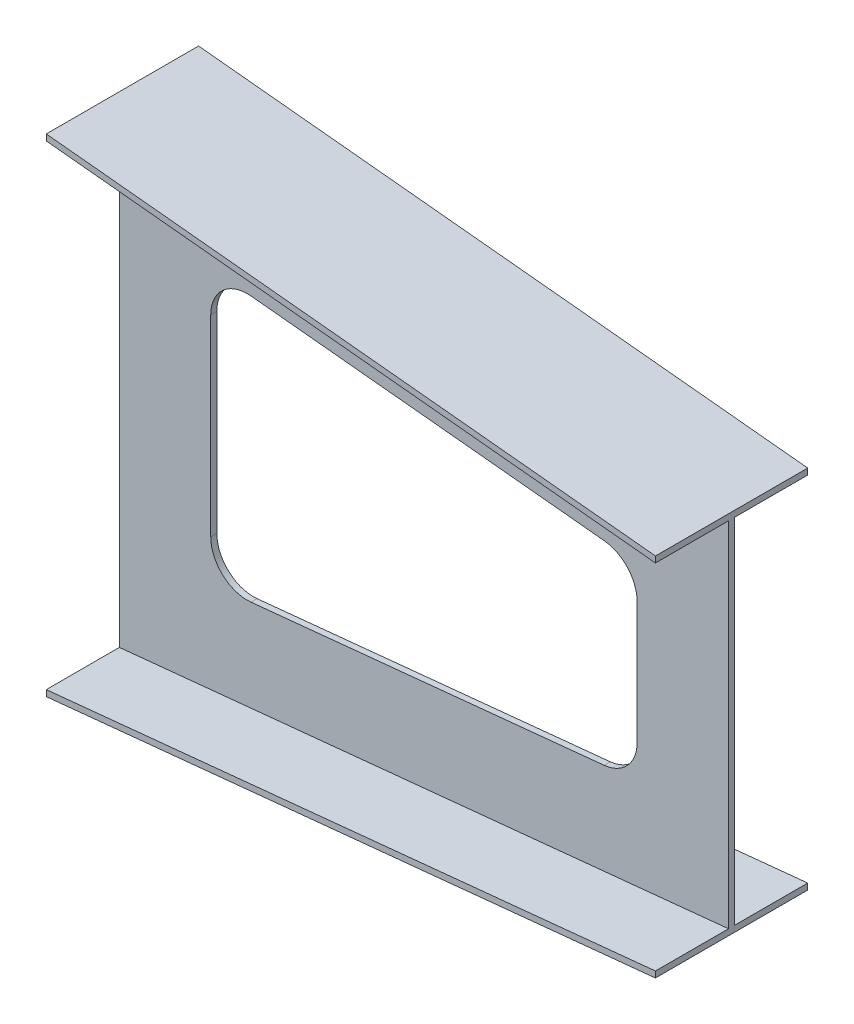
from build123d import *

# Parameters (mm, degrees)
CUT_EXTRUDE1_DEPTH = 10


with BuildPart() as part:
    # Sketch1 → Loft4 section 0
    with BuildSketch(Plane(origin=(0, 0, 0), x_dir=(0, 0, -1), z_dir=(1, 0, 0))):
        with BuildLine():
            Line((-130, 400), (120, 400))
            Line((120, 400), (120, 390))
            Line((120, 390), (0, 390))
            Line((0, 390), (0, -390))
            Line((0, -390), (120, -390))
            Line((120, -390), (120, -400))
            Line((120, -400), (-130, -400))
            Line((-130, -400), (-130, -390))
            Line((-130, -390), (-10, -390))
            Line((-10, -390), (-10, 390))
            Line((-10, 390), (-130, 390))
            Line((-130, 390), (-130, 400))
        make_face()
    # Sketch4 → Loft4 section 1
    with BuildSketch(Plane(origin=(1000, 0, -1000), x_dir=(0, 0, 1), z_dir=(-1, 0, 0))):
        with BuildLine():
            Line((880, 300), (1130, 300))
            Line((1130, 300), (1130, 290))
            Line((1130, 290), (1010, 290))
            Line((1010, 290), (1010, -290))
            Line((1010, -290), (1130, -290))
            Line((1130, -290), (1130, -300))
            Line((1130, -300), (880, -300))
            Line((880, -300), (880, -290))
            Line((880, -290), (1000, -290))
            Line((1000, -290), (1000, 290))
            Line((1000, 290), (880, 290))
            Line((880, 290), (880, 300))
        make_face()
    loft()

    # Sketch6 → Cut-Extrude1 (cut)
    with BuildSketch(Plane.XY.offset(10)):
        with BuildLine():
            Line((215.970223141, -217.654843369), (795.970223141, -159.654843369))
            ThreePointArc((795.970223141, -159.654843369), (834.487152013, -140.212931202), (850, -99.952611956))
            Line((850, -99.952611956), (850, 99.952611956))
            ThreePointArc((850, 99.952611956), (834.487152013, 140.212931202), (795.970223141, 159.654843369))
            Line((795.970223141, 159.654843369), (215.970223141, 217.654843369))
            ThreePointArc((215.970223141, 217.654843369), (169.739680754, 202.43976397), (150, 157.952611956))
            Line((150, 157.952611956), (150, -157.952611956))
            ThreePointArc((150, -157.952611956), (169.739680754, -202.43976397), (215.970223141, -217.654843369))
        make_face()
    extrude(amount=-CUT_EXTRUDE1_DEPTH, mode=Mode.SUBTRACT)


solid = part.part
